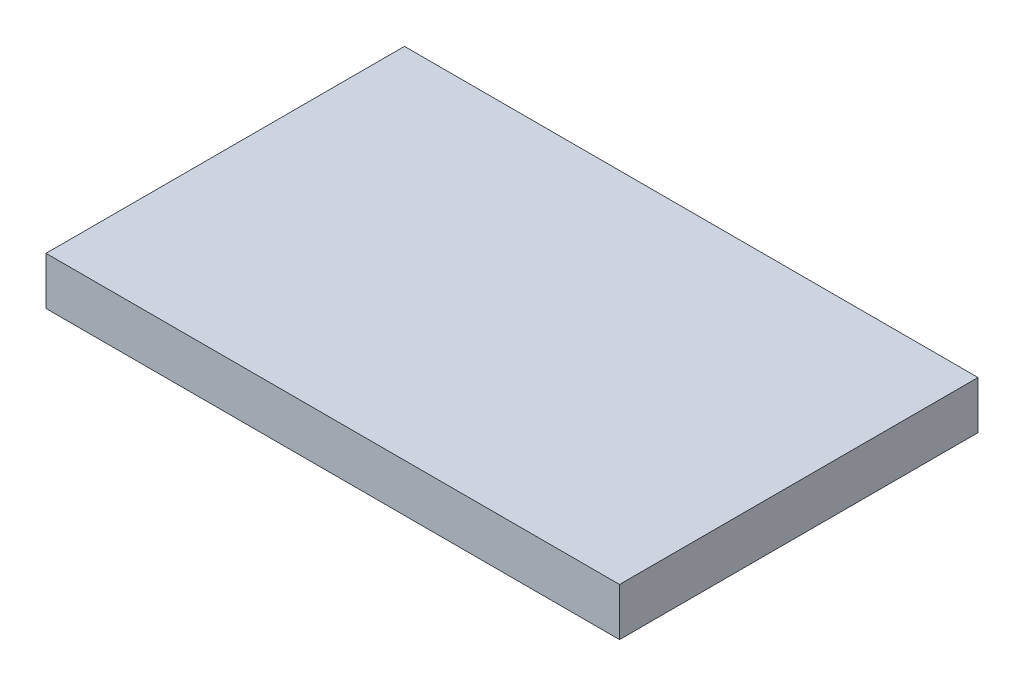
from build123d import *

# Parameters (mm, degrees)
SKETCH1_W           = 120
SKETCH1_H           = 75
BOSS_EXTRUDE1_DEPTH = 10


with BuildPart() as part:
    # Sketch1 → Boss-Extrude1 (new body)
    with BuildSketch(Plane(origin=(0, 0, 0), x_dir=(1, 0, 0), z_dir=(0, 1, 0))):
        Rectangle(SKETCH1_W, SKETCH1_H)
    extrude(amount=BOSS_EXTRUDE1_DEPTH)


solid = part.part
